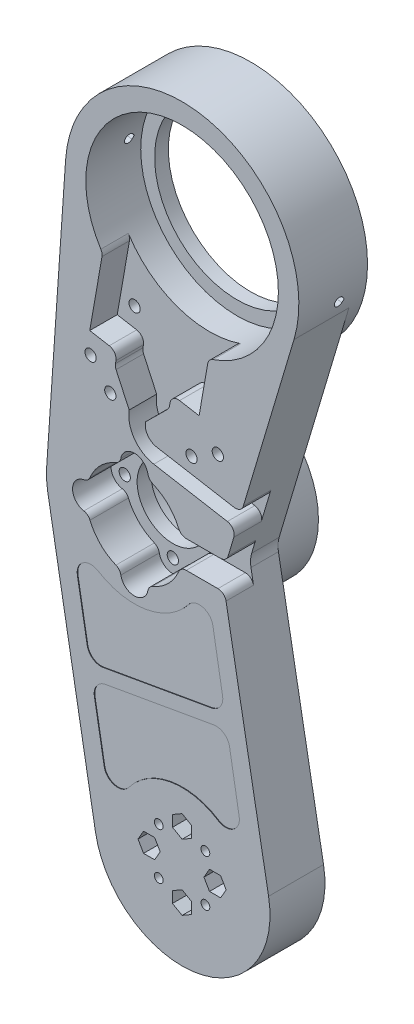
from build123d import *

# Parameters (mm, degrees)
MAIN_R                   = 32
MAIN_R_2                 = 25
MAIN_R_3                 = 16.25
MAIN_R_4                 = 2.05
MAIN_R_5                 = 35.05
BOSS_EXTRUDE10_DEPTH     = 20
BOSS_EXTRUDE11_START     = 6
MAIN_18_R                = 25
BOSS_EXTRUDE11_DEPTH     = 14
BOSS_EXTRUDE12_START     = 1
MAIN_19_R                = 25
MAIN_19_R_2              = 2.05
MAIN_19_R_3              = 13
BOSS_EXTRUDE12_DEPTH     = 5
BOSS_EXTRUDE13_START     = -15
MAIN_20_R                = 32
MAIN_20_R_2              = 25
BOSS_EXTRUDE13_DEPTH     = 15
BOSS_EXTRUDE14_START     = -5
MAIN_21_R                = 42.5
MAIN_21_R_2              = 35.05
MAIN_21_R_3              = 30
BOSS_EXTRUDE14_DEPTH     = 5
MAIN_24_R                = 16.25
CUT_EXTRUDE1_DEPTH       = 3.5
SKETCH1_R                = 2.05
SKETCH1_R_2              = 1.6
CUT_EXTRUDE2_DEPTH       = 7
CUT_EXTRUDE3_START       = -7
SKETCH1_4_R              = 1.6
CUT_EXTRUDE3_DEPTH       = 13
CUT_EXTRUDE4_START       = -10
CUT_EXTRUDE4_DEPTH       = 10
CUT_EXTRUDE5_START       = -10
SKETCH2_12_R             = 2.05
CUT_EXTRUDE5_DEPTH       = 7
CUT_EXTRUDE6_START       = -17
SKETCH2_13_R             = 1.6
CUT_EXTRUDE6_DEPTH       = 7
BOSS_EXTRUDE15_DEPTH     = 10
INTERSECT1_START         = 10
INTERSECT1_DEPTH         = 10
FILLET1_R                = 3
CUT_EXTRUDE8_DEPTH       = 10
FILLET3_R                = 3
FILLET4_R                = 3.25
CUT_EXTRUDE10_DEPTH      = 13
CUT_EXTRUDE11_REACH      = 248.187
SKETCH6_R                = 1.6
SKETCH6_3_R              = 1.6
CUT_EXTRUDE12_DEPTH      = 3.5
SKETCH4_R                = 2.05
CUT_EXTRUDE13_DEPTH      = 7
CUT_EXTRUDE14_START      = -7
SKETCH4_3_R              = 1.6
CUT_EXTRUDE14_DEPTH      = 13
FILLET5_R                = 10
CUT_EXTRUDE15_START      = -12.6
CUT_EXTRUDE15_DEPTH      = 12.6
CUT_EXTRUDE16_DEPTH      = 256.538758289
CUT_EXTRUDE16_DEPTH_BACK = 256.538758289
CUT_EXTRUDE17_START      = -0.2
CUT_EXTRUDE17_DEPTH      = 0.2
CUT_EXTRUDE18_DEPTH      = 0.4


# Read off the part's stored shape, not the designer's step: Intersect1
with BuildPart() as part:
    # Main → Boss-Extrude10 (new body)
    # profile 1 of 6: a face of its own
    with BuildSketch(Plane(origin=(0, 0, 0), x_dir=(0, 1, 0), z_dir=(0, 0, 1))):
        with Locations((98.480775301, 17.364817767)):
            Circle(MAIN_R)
        with Locations(Location((98.480775301, 17.364817767, 0), (0, 0, 270))):
            Circle(MAIN_R_2, mode=Mode.SUBTRACT)
    # profile 2 of 6: a face of its own
    with BuildSketch(Plane(origin=(0, 0, 0), x_dir=(0, 1, 0), z_dir=(0, 0, 1))):
        with BuildLine():
            Line((92.924033616, 48.878665863), (-5.556741685, 31.513848096))
            ThreePointArc((-5.556741685, 31.513848096), (20.56920351, 24.51342218), (32, 0))
            ThreePointArc((32, 0), (24.566327125, -20.505988676), (5.719026775, -31.484801615))
            Line((5.719026775, -31.484801615), (98.480775301, -14.635182233))
            ThreePointArc((98.480775301, -14.635182233), (66.602544962, 14.575833999), (92.924033616, 48.878665863))
        make_face()
    # profile 3 of 6: a face of its own
    with BuildSketch(Plane(origin=(0, 0, 0), x_dir=(0, 1, 0), z_dir=(0, 0, 1))):
        Circle(MAIN_R)
        Circle(MAIN_R_3, mode=Mode.SUBTRACT)
    # profile 4 of 6: a face of its own
    with BuildSketch(Plane(origin=(0, 0, 0), x_dir=(0, 1, 0), z_dir=(0, 0, 1))):
        Circle(MAIN_R_3)
        with Locations(Location((0, 12, 0), (0, 0, 270))):
            Circle(MAIN_R_4, mode=Mode.SUBTRACT)
        with Locations(Location((-12, 0, 0), (0, 0, 270))):
            Circle(MAIN_R_4, mode=Mode.SUBTRACT)
        with Locations(Location((0, -12, 0), (0, 0, 270))):
            Circle(MAIN_R_4, mode=Mode.SUBTRACT)
        with Locations(Location((12, 0, 0), (0, 0, 270))):
            Circle(MAIN_R_4, mode=Mode.SUBTRACT)
    # profile 5 of 6: a face of its own
    with BuildSketch(Plane(origin=(0, 0, 0), x_dir=(0, 1, 0), z_dir=(0, 0, 1))):
        with BuildLine():
            Line((200.891680149, 42.399924481), (100.6754928, 49.289466787))
            ThreePointArc((100.6754928, 49.289466787), (121.871275082, 39.202503542), (130.480775301, 17.364817767))
            ThreePointArc((130.480775301, 17.364817767), (121.108192299, -5.262599231), (98.480775301, -14.635182233))
            Line((98.480775301, -14.635182233), (185.812766687, -40.722055245))
            ThreePointArc((185.812766687, -40.722055245), (156.159327252, 7.58598834), (200.891680149, 42.399924481))
        make_face()
    # profile 6 of 6: a face of its own
    with BuildSketch(Plane(origin=(0, 0, 0), x_dir=(0, 1, 0), z_dir=(0, 0, 1))):
        with BuildLine():
            ThreePointArc((240.476820971, 0), (229.042328492, 29.00317642), (200.891680149, 42.399924481))
            ThreePointArc((200.891680149, 42.399924481), (156.159327252, 7.58598834), (185.812766687, -40.722055245))
            ThreePointArc((185.812766687, -40.722055245), (223.366559971, -34.082417073), (240.476820971, 0))
        make_face()
        with Locations(Location((197.976820971, 0, 0), (0, 0, 270))):
            Circle(MAIN_R_5, mode=Mode.SUBTRACT)
    extrude(amount=BOSS_EXTRUDE10_DEPTH)

    # Main<18> → Boss-Extrude11 (add)
    with BuildSketch(Plane(origin=(0, 0, 0), x_dir=(0, 1, 0), z_dir=(0, 0, 1)).offset(BOSS_EXTRUDE11_START)):
        with Locations(Location((98.480775301, 17.364817767, 0), (0, 0, 270))):
            Circle(MAIN_18_R)
        with BuildLine():
            ThreePointArc((103.429491894, 34.150532052), (110.855143972, 29.739186437), (115.266489587, 22.31353436))
            ThreePointArc((115.266489587, 22.31353436), (120.980775301, 17.364817767), (115.266489587, 12.416101174))
            ThreePointArc((115.266489587, 12.416101174), (110.855143972, 4.990449096), (103.429491894, 0.579103481))
            ThreePointArc((103.429491894, 0.579103481), (98.480775301, -5.135182233), (93.532058708, 0.579103481))
            ThreePointArc((93.532058708, 0.579103481), (86.10640663, 4.990449096), (81.695061016, 12.416101174))
            ThreePointArc((81.695061016, 12.416101174), (75.980775301, 17.364817767), (81.695061016, 22.31353436))
            ThreePointArc((81.695061016, 22.31353436), (86.10640663, 29.739186437), (93.532058708, 34.150532052))
            ThreePointArc((93.532058708, 34.150532052), (98.480775301, 39.864817767), (103.429491894, 34.150532052))
        make_face(mode=Mode.SUBTRACT)
    extrude(amount=BOSS_EXTRUDE11_DEPTH)

    # Main<19> → Boss-Extrude12 (add)
    with BuildSketch(Plane(origin=(0, 0, 0), x_dir=(0, 1, 0), z_dir=(0, 0, 1)).offset(BOSS_EXTRUDE12_START)):
        with Locations(Location((98.480775301, 17.364817767, 0), (0, 0, 270))):
            Circle(MAIN_19_R)
        with Locations(Location((98.480775301, -0.135182233, 0), (0, 0, 270))):
            Circle(MAIN_19_R_2, mode=Mode.SUBTRACT)
        with Locations(Location((80.980775301, 17.364817767, 0), (0, 0, 270))):
            Circle(MAIN_19_R_2, mode=Mode.SUBTRACT)
        with Locations(Location((98.480775301, 17.364817767, 0), (0, 0, 270))):
            Circle(MAIN_19_R_3, mode=Mode.SUBTRACT)
        with Locations(Location((98.480775301, 34.864817767, 0), (0, 0, 270))):
            Circle(MAIN_19_R_2, mode=Mode.SUBTRACT)
        with Locations(Location((115.980775301, 17.364817767, 0), (0, 0, 270))):
            Circle(MAIN_19_R_2, mode=Mode.SUBTRACT)
    extrude(amount=BOSS_EXTRUDE12_DEPTH)

    # Main<20> → Boss-Extrude13 (add)
    with BuildSketch(Plane(origin=(0, 0, 0), x_dir=(0, 1, 0), z_dir=(0, 0, 1)).offset(BOSS_EXTRUDE13_START)):
        with Locations(Location((98.480775301, 17.364817767, 0), (0, 0, 270))):
            Circle(MAIN_20_R)
        with Locations(Location((98.480775301, 17.364817767, 0), (0, 0, 270))):
            Circle(MAIN_20_R_2, mode=Mode.SUBTRACT)
    extrude(amount=BOSS_EXTRUDE13_DEPTH)

    # Main<21> → Boss-Extrude14 (add)
    # profile 1 of 2: a face of its own
    with BuildSketch(Plane(origin=(0, 0, 0), x_dir=(0, 1, 0), z_dir=(0, 0, 1)).offset(BOSS_EXTRUDE14_START)):
        with Locations(Location((197.976820971, 0, 0), (0, 0, 86.067286144))):
            Circle(MAIN_21_R)
        with Locations(Location((197.976820971, 0, 0), (0, 0, 270))):
            Circle(MAIN_21_R_2, mode=Mode.SUBTRACT)
    # profile 2 of 2: a face of its own
    with BuildSketch(Plane(origin=(0, 0, 0), x_dir=(0, 1, 0), z_dir=(0, 0, 1)).offset(BOSS_EXTRUDE14_START)):
        with Locations(Location((197.976820971, 0, 0), (0, 0, 270))):
            Circle(MAIN_21_R_2)
        with Locations(Location((197.976820971, 0, 0), (0, 0, 270))):
            Circle(MAIN_21_R_3, mode=Mode.SUBTRACT)
    extrude(amount=BOSS_EXTRUDE14_DEPTH)

    # Main<24> → Cut-Extrude1 (cut)
    with BuildSketch(Plane(origin=(0, 0, 0), x_dir=(0, 1, 0), z_dir=(0, 0, 1))):
        with Locations(Location((0, 0, 0), (0, 0, 270))):
            Circle(MAIN_24_R)
    extrude(amount=CUT_EXTRUDE1_DEPTH, mode=Mode.SUBTRACT)

    # Sketch1 → Cut-Extrude2 (cut)
    # profile 1 of 4: a face of its own
    with BuildSketch(Plane.XY.offset(20)):
        with Locations((-33.29387447, 143.895697436)):
            Circle(SKETCH1_R)
        with Locations((-33.29387447, 143.895697436)):
            Circle(SKETCH1_R_2, mode=Mode.SUBTRACT)
    # profile 2 of 4: a face of its own
    with BuildSketch(Plane.XY.offset(20)):
        with Locations((-33.29387447, 143.895697436)):
            Circle(SKETCH1_R_2)
    # profile 3 of 4: a face of its own
    with BuildSketch(Plane.XY.offset(20)):
        with Locations((13.006265594, 135.815039664)):
            Circle(SKETCH1_R)
        with Locations((13.006265594, 135.815039664)):
            Circle(SKETCH1_R_2, mode=Mode.SUBTRACT)
    # profile 4 of 4: a face of its own
    with BuildSketch(Plane.XY.offset(20)):
        with Locations((13.006265594, 135.815039664)):
            Circle(SKETCH1_R_2)
    extrude(amount=-CUT_EXTRUDE2_DEPTH, mode=Mode.SUBTRACT)

    # Sketch1<4> → Cut-Extrude3 (cut)
    with BuildSketch(Plane.XY.offset(20).offset(CUT_EXTRUDE3_START)):
        with Locations((-33.29387447, 143.895697436)):
            Circle(SKETCH1_4_R)
        with Locations((13.006265594, 135.815039664)):
            Circle(SKETCH1_4_R)
    extrude(amount=-CUT_EXTRUDE3_DEPTH, mode=Mode.SUBTRACT)

    # Sketch2 → Cut-Extrude4 (cut)
    with BuildSketch(Plane.XY.offset(20).offset(CUT_EXTRUDE4_START)):
        with BuildLine():
            Line((-32.418215797, 158.293450187), (-28.942657764, 178.207525041))
            ThreePointArc((-28.942657764, 178.207525041), (-11.90330288, 165.009960633), (9.636870325, 164.277663262))
            Line((9.636870325, 164.277663262), (7.380202471, 151.34752308))
            Line((7.380202471, 151.34752308), (6.193893138, 144.550268475))
            Line((6.193893138, 144.550268475), (-3.854222365, 146.303943141))
            Line((-3.854222365, 146.303943141), (-23.556409627, 149.742520916))
            Line((-23.556409627, 149.742520916), (-33.60452513, 151.496195582))
            Line((-33.60452513, 151.496195582), (-32.418215797, 158.293450187))
        make_face()
    extrude(amount=CUT_EXTRUDE4_DEPTH, mode=Mode.SUBTRACT)

    # Sketch2<12> → Cut-Extrude5 (cut)
    with BuildSketch(Plane.XY.offset(20).offset(CUT_EXTRUDE5_START)):
        with Locations((-27.295647109, 157.399419965)):
            Circle(SKETCH2_12_R)
        with Locations((2.257633783, 152.241553302)):
            Circle(SKETCH2_12_R)
    extrude(amount=-CUT_EXTRUDE5_DEPTH, mode=Mode.SUBTRACT)

    # Sketch2<13> → Cut-Extrude6 (cut)
    with BuildSketch(Plane.XY.offset(20).offset(CUT_EXTRUDE6_START)):
        with Locations((-27.295647109, 157.399419965)):
            Circle(SKETCH2_13_R)
        with Locations((2.257633783, 152.241553302)):
            Circle(SKETCH2_13_R)
    extrude(amount=-CUT_EXTRUDE6_DEPTH, mode=Mode.SUBTRACT)


with BuildPart() as body_2:
    # Sketch3 → Boss-Extrude15 (new body)
    with BuildSketch(Plane.XY.offset(20)):
        with BuildLine():
            Line((-3.854222365, 146.303943141), (-23.556409627, 149.742520916))
            Line((-23.556409627, 149.742520916), (-24.416054071, 144.816974101))
            Line((-24.416054071, 144.816974101), (-19.262897785, 133.623516702))
            ThreePointArc((-19.262897785, 133.623516702), (-19.251459791, 133.69298479), (-19.239577417, 133.762378249))
            ThreePointArc((-19.239577417, 133.762378249), (-15.839829323, 136.213490782), (-13.307502157, 132.873796353))
            Line((-13.307502157, 132.873796353), (-4.713866809, 141.378396325))
            Line((-4.713866809, 141.378396325), (-3.854222365, 146.303943141))
        make_face()
        with BuildLine():
            ThreePointArc((-19.239577417, 133.762378249), (-19.251459791, 133.69298479), (-19.262897785, 133.623516702))
            ThreePointArc((-19.262897785, 133.623516702), (-17.362353479, 125.488630075), (-10.2945922, 121.034957479))
            ThreePointArc((-10.2945922, 121.034957479), (-6.823477444, 123.474498901), (-9.263018867, 126.945613657))
            ThreePointArc((-9.263018867, 126.945613657), (-12.494122393, 128.996133334), (-13.328921238, 132.730804916))
            ThreePointArc((-13.328921238, 132.730804916), (-13.317350128, 132.802171578), (-13.307502157, 132.873796353))
            ThreePointArc((-13.307502157, 132.873796353), (-15.839829323, 136.213490782), (-19.239577417, 133.762378249))
        make_face()
        with BuildLine():
            ThreePointArc((-9.263018867, 126.945613657), (-6.823477444, 123.474498901), (-10.2945922, 121.034957479))
            Line((-10.2945922, 121.034957479), (19.80323368, 115.782052621))
            Line((19.80323368, 115.782052621), (21.532431998, 121.570953903))
            Line((21.532431998, 121.570953903), (-9.263018867, 126.945613657))
        make_face()
    extrude(amount=-BOSS_EXTRUDE15_DEPTH)


with BuildPart() as intersect1_tool:
    # Intersect1 outline → Intersect1 (new body)
    with BuildSketch(Plane.XY.offset(INTERSECT1_START)):
        with BuildLine():
            Line((-10.2945922, 121.034957479), (19.80323368, 115.782052621))
            Line((19.80323368, 115.782052621), (21.532431998, 121.570953903))
            Line((21.532431998, 121.570953903), (-9.263018867, 126.945613657))
            ThreePointArc((-9.263018867, 126.945613657), (-12.494122393, 128.996133334), (-13.328921238, 132.730804916))
            ThreePointArc((-13.328921238, 132.730804916), (-13.317350128, 132.802171578), (-13.307502157, 132.873796353))
            Line((-13.307502157, 132.873796353), (-4.713866809, 141.378396325))
            Line((-4.713866809, 141.378396325), (-3.854222365, 146.303943141))
            Line((-3.854222365, 146.303943141), (-23.556409627, 149.742520916))
            Line((-23.556409627, 149.742520916), (-24.416054071, 144.816974101))
            Line((-24.416054071, 144.816974101), (-19.262897785, 133.623516702))
            ThreePointArc((-19.262897785, 133.623516702), (-17.362353479, 125.488630075), (-10.2945922, 121.034957479))
        make_face()
    extrude(amount=INTERSECT1_DEPTH)


with BuildPart() as part_1:
    add(part.part)

    # Intersect1: cut by intersect1_tool
    add(intersect1_tool.part, mode=Mode.SUBTRACT)

    # Fillet1
    fillet1_edges = [part_1.edges().sort_by_distance(p)[0] for p in [
        (-28.942657764, 178.207525041, 15),
        (9.636870325, 164.277663262, 15),
        (-3.854222365, 146.303943141, 15),
        (19.80323368, 115.782052621, 15),
        (21.532431998, 121.570953903, 15),
        (-23.556409627, 149.742520916, 15),
        (-24.416054071, 144.816974101, 15),
        (-4.713866809, 141.378396325, 15),
    ]]
    fillet(fillet1_edges, radius=FILLET1_R)

    # Sketch5 → Cut-Extrude8 (cut)
    with BuildSketch(Plane.XY.offset(20)):
        Polygon((16.128728447, 103.480775301), (14.635182233, 98.480775301), (15.543402467, 93.480775301), (-1.864817767, 93.480775301), (-1.864817767, 103.480775301), align=None)
    extrude(amount=-CUT_EXTRUDE8_DEPTH, mode=Mode.SUBTRACT)

    # Fillet3
    # the kernel refuses this fillet: 3 mm, written as the material it takes off along each edge
    with BuildSketch(Plane(origin=(-22.31353436, 115.266489587, 6), x_dir=(0.018092404043592625, 0.999836319062237, 0), z_dir=(0, 0, 1)), Plane(origin=(-12.416101174, 81.695061016, 6), x_dir=(-0.018092404043601622, -0.9998363190622368, 0), z_dir=(0, 0, 1)), Plane(origin=(-34.150532052, 93.532058708, 6), x_dir=(-0.9998363190622366, 0.018092404043610618, 0), z_dir=(0, 0, 1))) as fillet3_piece_1:
        with BuildLine():
            CenterArc((2.089627747, 2.960990062), FILLET3_R, 203.616579082, 57.133535261)
            ThreePointArc((-0.659112793, 1.75914754), (-0.305934486, 0.888424365), (0, 0))
            ThreePointArc((0, 0), (0.803702979, 0.065016563), (1.607405959, 0))
        make_face()
    extrude(amount=18.696427991, mode=Mode.SUBTRACT)
    with BuildSketch(Plane(origin=(-12.416101174, 115.266489587, 6), x_dir=(0.9426230632930053, -0.33385889316912154, 0), z_dir=(0, 0, 1)), Plane(origin=(-22.31353436, 81.695061016, 6), x_dir=(-0.9426230632930039, 0.3338588931691254, 0), z_dir=(0, 0, 1)), Plane(origin=(-34.150532052, 103.429491894, 6), x_dir=(0.33385889316913037, 0.9426230632930022, 0), z_dir=(0, 0, 1))) as fillet3_piece_2:
        with BuildLine():
            CenterArc((2.039591585, 2.995675622), FILLET3_R, 209.789723377, 57.133535261)
            ThreePointArc((-0.563972147, 1.505220693), (-0.221102713, 0.775421964), (0, 0))
            ThreePointArc((0, 0), (0.939285598, 0.025225536), (1.878571196, 0))
        make_face()
    extrude(amount=18.696427991, mode=Mode.SUBTRACT)
    with BuildSketch(Plane(origin=(-0.594307935, 93.480775301, 25.260190642), x_dir=(-0.33850165532610577, -0.9409657960529099, 0), z_dir=(0, 0, -1))) as fillet3_piece_3:
        with BuildLine():
            CenterArc((2.110664092, -2.995368756), FILLET3_R, 93.184063487, 67.030323428)
            Line((-0.712233296, -1.97986379), (0, 0))
            ThreePointArc((0, 0), (0.972016358, -0.02701559), (1.944032717, 0))
        make_face()
    extrude(amount=15.260190642, mode=Mode.SUBTRACT)
    with BuildSketch(Plane(origin=(-0.594307935, 103.480775301, 25.260190642), x_dir=(1, 0, 0), z_dir=(0, 0, -1))) as fillet3_piece_4:
        with BuildLine():
            CenterArc((2.104076257, -3), FILLET3_R, 90, 67.030323428)
            ThreePointArc((-0.658058293, -1.829268293), (-0.3036084, -0.923778968), (0, 0))
            Line((0, 0), (2.104076257, 0))
        make_face()
    extrude(amount=15.260190642, mode=Mode.SUBTRACT)
    with BuildSketch(Plane(origin=(15.543402467, 93.480775301, 26.260395145), x_dir=(-1, 0, 0), z_dir=(0, 0, -1))) as fillet3_piece_5:
        with BuildLine():
            CenterArc((FILLET3_R * 0.834719352725, -FILLET3_R), FILLET3_R, 90, 79.704811763)
            Line((-FILLET3_R * 0.149180697748, -FILLET3_R * 0.821280413277), (0, 0))
            Line((0, 0), (FILLET3_R * 0.834719352725, 0))
        make_face()
    extrude(amount=16.260395145, mode=Mode.SUBTRACT)
    with BuildSketch(Plane(origin=(16.128728447, 103.480775301, 25.587134331), x_dir=(-1, 0, 0), z_dir=(0, 0, -1))) as fillet3_piece_6:
        with BuildLine():
            CenterArc((FILLET3_R * 0.744951244073, FILLET3_R), FILLET3_R, 196.63137158, 73.36862842)
            Line((-FILLET3_R * 0.213214761691, FILLET3_R * 0.713786958023), (0, 0))
            Line((0, 0), (FILLET3_R * 0.744951244073, 0))
        make_face()
    extrude(amount=15.587134331, mode=Mode.SUBTRACT)

    # Fillet4
    # the kernel refuses this fillet: 3.25 mm, written as the material it takes off along each edge
    with BuildSketch(Plane(origin=(-0.579103481, 93.532058708, 6), x_dir=(-0.3369248544443787, -0.9415315408724416, 0), z_dir=(0, 0, 1))) as fillet4_piece_1:
        with BuildLine():
            CenterArc((2.177302746, 3.244730367), FILLET4_R, 210.922973776, 55.813817694)
            ThreePointArc((-0.610738754, 1.574603248), (-0.238404786, 0.813275069), (0, 0))
            ThreePointArc((0, 0), (0.996151583, 0.028374946), (1.992303167, 0))
        make_face()
    extrude(amount=8.980757916, mode=Mode.SUBTRACT)
    with BuildSketch(Plane(origin=(-0.579103481, 103.429491894, 6), x_dir=(-0.3369248544443786, 0.9415315408724416, 0), z_dir=(0, 0, 1))) as fillet4_piece_2:
        with BuildLine():
            CenterArc((2.177302746, -3.244730367), FILLET4_R, 93.26320853, 55.813817694)
            ThreePointArc((-0.610738754, -1.574603248), (-0.238404786, -0.813275069), (0, 0))
            ThreePointArc((0, 0), (0.996151583, -0.028374946), (1.992303167, 0))
        make_face()
    extrude(amount=8.980757916, mode=Mode.SUBTRACT)

    # Sketch7 → Cut-Extrude10 (cut)
    with BuildSketch(Plane.XY.offset(20)):
        Polygon((0, 7.958548116), (3.5, 9.979274058), (3.5, 14.020725942), (0, 16.041451884), (-3.5, 14.020725942), (-3.5, 9.979274058), align=None)
        Polygon((-7.958548116, 0), (-9.979274058, 3.5), (-14.020725942, 3.5), (-16.041451884, 0), (-14.020725942, -3.5), (-9.979274058, -3.5), align=None)
        Polygon((7.958548116, 0), (9.979274058, -3.5), (14.020725942, -3.5), (16.041451884, 0), (14.020725942, 3.5), (9.979274058, 3.5), align=None)
        Polygon((0, -7.958548116), (-3.5, -9.979274058), (-3.5, -14.020725942), (0, -16.041451884), (3.5, -14.020725942), (3.5, -9.979274058), align=None)
    extrude(amount=-CUT_EXTRUDE10_DEPTH, mode=Mode.SUBTRACT)

    # Sketch6 → Cut-Extrude11 (cut, up to next)
    with BuildSketch(Plane(origin=(0, 0, 3.5), x_dir=(1, 0, 0), z_dir=(0, 0, -1)), mode=Mode.PRIVATE) as cut_extrude11_sk1:
        with Locations(Location((8.485281374, -8.485281374, 0), (0, 0, 180))):
            Circle(SKETCH6_R)
    cut_extrude11_tool1 = extrude(cut_extrude11_sk1.sketch, amount=-CUT_EXTRUDE11_REACH, mode=Mode.PRIVATE) & part_1.part
    # Sketch6 → Cut-Extrude11 (cut, up to next)
    with BuildSketch(Plane(origin=(0, 0, 3.5), x_dir=(1, 0, 0), z_dir=(0, 0, -1)), mode=Mode.PRIVATE) as cut_extrude11_sk2:
        with Locations(Location((-8.485281374, -8.485281374, 0), (0, 0, 180))):
            Circle(SKETCH6_R)
    cut_extrude11_tool2 = extrude(cut_extrude11_sk2.sketch, amount=-CUT_EXTRUDE11_REACH, mode=Mode.PRIVATE) & part_1.part
    # Sketch6 → Cut-Extrude11 (cut, up to next)
    with BuildSketch(Plane(origin=(0, 0, 3.5), x_dir=(1, 0, 0), z_dir=(0, 0, -1)), mode=Mode.PRIVATE) as cut_extrude11_sk3:
        with Locations(Location((-8.485281374, 8.485281374, 0), (0, 0, 180))):
            Circle(SKETCH6_R)
    cut_extrude11_tool3 = extrude(cut_extrude11_sk3.sketch, amount=-CUT_EXTRUDE11_REACH, mode=Mode.PRIVATE) & part_1.part
    # Sketch6 → Cut-Extrude11 (cut, up to next)
    with BuildSketch(Plane(origin=(0, 0, 3.5), x_dir=(1, 0, 0), z_dir=(0, 0, -1)), mode=Mode.PRIVATE) as cut_extrude11_sk4:
        with Locations(Location((8.485281374, 8.485281374, 0), (0, 0, 180))):
            Circle(SKETCH6_R)
    cut_extrude11_tool4 = extrude(cut_extrude11_sk4.sketch, amount=-CUT_EXTRUDE11_REACH, mode=Mode.PRIVATE) & part_1.part
    add(cut_extrude11_tool1.solids().sort_by_distance((8.485281, 8.485281, 3.5))[0], mode=Mode.SUBTRACT)
    add(cut_extrude11_tool2.solids().sort_by_distance((-8.485281, 8.485281, 3.5))[0], mode=Mode.SUBTRACT)
    add(cut_extrude11_tool3.solids().sort_by_distance((-8.485281, -8.485281, 3.5))[0], mode=Mode.SUBTRACT)
    add(cut_extrude11_tool4.solids().sort_by_distance((8.485281, -8.485281, 3.5))[0], mode=Mode.SUBTRACT)

    # Sketch6<3> → Cut-Extrude12 (cut)
    # profile 1 of 4: a face of its own
    with BuildSketch(Plane(origin=(0, 0, 3.5), x_dir=(1, 0, 0), z_dir=(0, 0, -1))):
        Polygon((12.374368671, -8.485281374), (8.485281374, -12.374368671), (4.596194078, -8.485281374), (8.485281374, -4.596194078), align=None)
        with Locations(Location((8.485281374, -8.485281374, 0), (0, 0, 180))):
            Circle(SKETCH6_3_R, mode=Mode.SUBTRACT)
    # profile 2 of 4: a face of its own
    with BuildSketch(Plane(origin=(0, 0, 3.5), x_dir=(1, 0, 0), z_dir=(0, 0, -1))):
        Polygon((12.374368671, 8.485281374), (8.485281374, 4.596194078), (4.596194078, 8.485281374), (8.485281374, 12.374368671), align=None)
        with Locations(Location((8.485281374, 8.485281374, 0), (0, 0, 180))):
            Circle(SKETCH6_3_R, mode=Mode.SUBTRACT)
    # profile 3 of 4: a face of its own
    with BuildSketch(Plane(origin=(0, 0, 3.5), x_dir=(1, 0, 0), z_dir=(0, 0, -1))):
        Polygon((-8.485281374, -12.374368671), (-12.374368671, -8.485281374), (-8.485281374, -4.596194078), (-4.596194078, -8.485281374), align=None)
        with Locations(Location((-8.485281374, -8.485281374, 0), (0, 0, 180))):
            Circle(SKETCH6_3_R, mode=Mode.SUBTRACT)
    # profile 4 of 4: a face of its own
    with BuildSketch(Plane(origin=(0, 0, 3.5), x_dir=(1, 0, 0), z_dir=(0, 0, -1))):
        Polygon((-12.374368671, 8.485281374), (-8.485281374, 12.374368671), (-4.596194078, 8.485281374), (-8.485281374, 4.596194078), align=None)
        with Locations(Location((-8.485281374, 8.485281374, 0), (0, 0, 180))):
            Circle(SKETCH6_3_R, mode=Mode.SUBTRACT)
    extrude(amount=-CUT_EXTRUDE12_DEPTH, mode=Mode.SUBTRACT)

    # Sketch4 → Cut-Extrude13 (cut)
    with BuildSketch(Plane.XY.offset(20)):
        with Locations((-26.123947105, 135.53853634)):
            Circle(SKETCH4_R)
        with Locations((3.429333787, 130.380669677)):
            Circle(SKETCH4_R)
    extrude(amount=-CUT_EXTRUDE13_DEPTH, mode=Mode.SUBTRACT)

    # Sketch4<3> → Cut-Extrude14 (cut)
    with BuildSketch(Plane.XY.offset(20).offset(CUT_EXTRUDE14_START)):
        with Locations((-26.123947105, 135.53853634)):
            Circle(SKETCH4_3_R)
        with Locations((3.429333787, 130.380669677)):
            Circle(SKETCH4_3_R)
    extrude(amount=-CUT_EXTRUDE14_DEPTH, mode=Mode.SUBTRACT)

    # Fillet5
    # the kernel refuses this fillet: 10 mm, written as the material it adds along each edge
    with BuildSketch(Plane(origin=(14.635182233, 98.480775301, 0), x_dir=(0.2862130419774193, 0.9581660057641536, 0), z_dir=(0, 0, 1))) as fillet5_piece_1:
        with BuildLine():
            CenterArc((FILLET5_R * 0.239401037471, -FILLET5_R), FILLET5_R, 90, 26.926559817)
            Line((-FILLET5_R * 0.213447021539, -FILLET5_R * 0.108412295144), (0, 0))
            Line((0, 0), (FILLET5_R * 0.239401037471, 0))
        make_face()
    extrude(amount=10)

    # Sketch11 → Cut-Extrude15 (cut)
    with BuildSketch(Plane(origin=(0, 0, -5), x_dir=(1, 0, 0), z_dir=(0, 0, -1)).offset(CUT_EXTRUDE15_START)):
        Polygon((36.935562019, -188.586706045), (37.932749574, -194.30034035), (39.9029683, -193.956482573), (38.905780745, -188.242848267), align=None)
        Polygon((-39.9029683, -201.997159369), (-38.905780745, -207.710793675), (-36.935562019, -207.366935898), (-37.932749574, -201.653301592), align=None)
    extrude(amount=CUT_EXTRUDE15_DEPTH, mode=Mode.SUBTRACT)

    # Sketch12 → Cut-Extrude16 (cut, two sides: drawn at the far end of the back side and taken through both)
    with BuildSketch(Plane(origin=(-70.965244101, 12.385402086, 0), x_dir=(-0.17192888877913734, -0.9851093630674571, 0), z_dir=(-0.9851093630674571, 0.17192888877913734, 0)).offset(-CUT_EXTRUDE16_DEPTH_BACK)):
        with BuildLine():
            Line((-195.028820009, 2.85), (-194.068820009, 3.57))
            ThreePointArc((-194.068820009, 3.57), (-195.028820009, 6.45), (-195.988820009, 3.57))
            Line((-195.988820009, 3.57), (-195.028820009, 2.85))
        make_face()
    extrude(amount=CUT_EXTRUDE16_DEPTH + CUT_EXTRUDE16_DEPTH_BACK, mode=Mode.SUBTRACT)

    # Sketch13 → Cut-Extrude17 (cut)
    with BuildSketch(Plane.XY.offset(20).offset(CUT_EXTRUDE17_START)):
        with BuildLine():
            Line((11.216121075, 80.878789543), (14.73896886, 60.471957704))
            ThreePointArc((14.73896886, 60.471957704), (13.902457546, 56.746161509), (10.680088309, 54.697346004))
            Line((10.680088309, 54.697346004), (-28.727908052, 47.74865299))
            ThreePointArc((-28.727908052, 47.74865299), (-32.464031122, 48.576931534), (-34.520187706, 51.804450867))
            Line((-34.520187706, 51.804450867), (-38.102120298, 72.118600055))
            ThreePointArc((-38.102120298, 72.118600055), (-35.980903807, 77.127394927), (-30.542537572, 77.235830003))
            ThreePointArc((-30.542537572, 77.235830003), (-12.973869601, 73.86940447), (2.346696735, 83.103643057))
            ThreePointArc((2.346696735, 83.103643057), (7.505535775, 84.877962975), (11.216121075, 80.878789543))
        make_face()
        with BuildLine():
            Line((-27.859667164, 42.824614225), (11.495341753, 49.763964123))
            ThreePointArc((11.495341753, 49.763964123), (15.238805902, 48.930535484), (17.290704081, 45.690498293))
            Line((17.290704081, 45.690498293), (20.782122955, 25.465724987))
            ThreePointArc((20.782122955, 25.465724987), (18.614987263, 20.445922067), (13.147471823, 20.41166743))
            ThreePointArc((13.147471823, 20.41166743), (-4.278252374, 23.89955521), (-19.411897142, 14.583224333))
            ThreePointArc((-19.411897142, 14.583224333), (-24.573146756, 12.723720079), (-28.333532449, 16.718185384))
            Line((-28.333532449, 16.718185384), (-31.915465041, 37.032334572))
            ThreePointArc((-31.915465041, 37.032334572), (-31.087186497, 40.768457642), (-27.859667164, 42.824614225))
        make_face()
    extrude(amount=CUT_EXTRUDE17_DEPTH, mode=Mode.SUBTRACT)

    # Sketch16 → Cut-Extrude18 (cut)
    # profile 1 of 4: a face of its own
    with BuildSketch(Plane(origin=(0, 0, 0), x_dir=(1, 0, 0), z_dir=(0, 0, -1))):
        Polygon((-23.653821426, -44.492169466), (-26.687656788, -61.176510295), (-38.142577357, -59.093159769), (-36.378393326, -49.391901259), (-32.46421961, -50.103888054), (-35.108741995, -42.40881894), (-32.099457902, -42.955961502), (-29.258525366, -50.686103858), (-28.132674325, -50.889528657), (-26.863022994, -43.906446338), align=None)
        Polygon((-29.377774386, -57.732318011), (-28.627207025, -53.607704848), (-33.863641933, -52.657220012), (-34.614209295, -56.781833175), align=None, mode=Mode.SUBTRACT)
    # profile 2 of 4: a face of its own
    with BuildSketch(Plane(origin=(0, 0, 0), x_dir=(1, 0, 0), z_dir=(0, 0, -1))):
        Polygon((-12.949170083, -46.433814886), (-9.739968515, -47.019538014), (-12.773803877, -63.703878843), (-24.228724446, -61.620528317), (-22.464540415, -51.919269807), (-14.218821414, -53.416897205), align=None)
        Polygon((-15.463921475, -60.259686559), (-14.713354114, -56.135073396), (-19.949789022, -55.18458856), (-20.700356384, -59.309201723), align=None, mode=Mode.SUBTRACT)
    # profile 3 of 4: a face of its own
    with BuildSketch(Plane(origin=(0, 0, 0), x_dir=(1, 0, 0), z_dir=(0, 0, -1))):
        Polygon((-1.550068564, -62.787055107), (-0.799501203, -58.662441944), (-9.045220205, -57.164814546), (-8.550687504, -54.446638355), (-0.304968503, -55.944265753), (0.445598859, -51.81965259), (-7.800120143, -50.322025192), (-7.281036173, -47.463556036), (4.173884396, -49.546906562), (1.140049034, -66.231247391), (-10.314871535, -64.147896865), (-9.795787566, -61.289427709), align=None)
    # profile 4 of 4: a face of its own
    with BuildSketch(Plane(origin=(0, 0, 0), x_dir=(1, 0, 0), z_dir=(0, 0, -1))):
        Polygon((6.608265469, -67.222407975), (3.598981376, -66.675265413), (10.266404524, -50.650301518), (14.170056267, -51.362288314), (15.053901945, -68.758615939), (11.844700377, -68.172892811), (11.672841495, -54.87662708), align=None)
    extrude(amount=-CUT_EXTRUDE18_DEPTH, mode=Mode.SUBTRACT)


with BuildPart() as body_2_1:
    add(body_2.part)

    # Intersect1: cut by intersect1_tool
    add(intersect1_tool.part, mode=Mode.SUBTRACT)


solid = part_1.part
